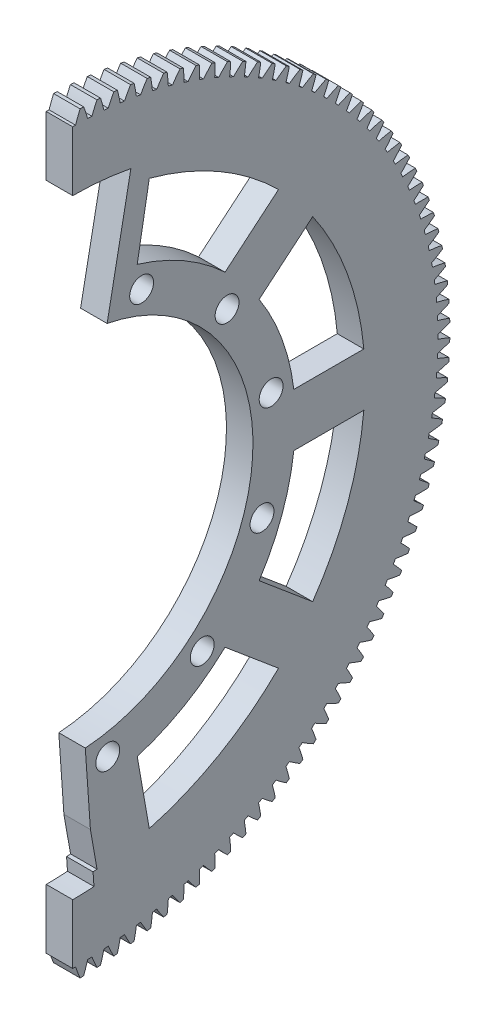
from build123d import *

# Parameters (mm, degrees)
SPUR_START                      = -20.891266915
SPUR_GEAR_AM_OUTLINE_R          = 55
SPUR_GEAR_AM_DEPTH              = 5
SKETCH4_R                       = 60.613652159
SKETCH4_R_2                     = 60
BOSS_EXTRUDE1_DEPTH             = 5
CUT_EXTRUDE1_DEPTH              = 103.636877326
CUT_EXTRUDE1_DEPTH_BACK         = 103.636877326
SKETCH5_R                       = 42
SKETCH5_R_2                     = 34
BOSS_EXTRUDE2_DEPTH             = 5
SKETCH8_W                       = 33.111314858
SKETCH8_H                       = 10
BOSS_EXTRUDE3_DEPTH             = 5
CIRPATTERN4_COUNT               = 3
CIRPATTERN4_ANGLE               = 80
CIRPATTERN4_THE_OTHER_WAY_COUNT = 3
CIRPATTERN4_THE_OTHER_WAY_ANGLE = 80
SKETCH6_R                       = 2.25
CUT_EXTRUDE3_DEPTH              = 101.612541733
CIRPATTERN2_COUNT               = 12
CUT_EXTRUDE4_DEPTH              = 103.636877326
CUT_EXTRUDE4_DEPTH_BACK         = 103.636877326


# Read off the part's stored shape, not the designer's step: spur gear_am
with BuildPart() as part:
    # spur gear_am outline → spur gear_am (new body)
    with BuildSketch(Plane.YZ.offset(SPUR_START)):
        with BuildLine():
            ThreePointArc((1.931612998, 70.839801204), (1.593102565, 70.848206303), (1.254555896, 70.85499688))
            ThreePointArc((1.254555896, 70.85499688), (0.807224415, 69.743494183), (0.407853655, 68.613871815))
            ThreePointArc((0.407853655, 68.613871815), (0, 68.615081622), (-0.407853655, 68.613871815))
            ThreePointArc((-0.407853655, 68.613871815), (-0.807224415, 69.743494183), (-1.254555896, 70.85499688))
            ThreePointArc((-1.254555896, 70.85499688), (-1.593102565, 70.848206303), (-1.931612998, 70.839801204))
            ThreePointArc((-1.931612998, 70.839801204), (-2.328626666, 69.709348265), (-2.67691497, 68.56294565))
            ThreePointArc((-2.67691497, 68.56294565), (-3.084412222, 68.545855954), (-3.491800918, 68.52634908))
            ThreePointArc((-3.491800918, 68.52634908), (-3.941449854, 69.636916292), (-4.438198282, 70.727230329))
            ThreePointArc((-4.438198282, 70.727230329), (-4.776099398, 70.705257751), (-5.11389188, 70.681673901))
            ThreePointArc((-5.11389188, 70.681673901), (-5.459788203, 69.534547303), (-5.756292645, 68.373673143))
            ThreePointArc((-5.756292645, 68.373673143), (-6.162612848, 68.33831836), (-6.568716158, 68.300553704))
            ThreePointArc((-6.568716158, 68.300553704), (-7.067737737, 69.389829225), (-7.612902727, 70.456758854))
            ThreePointArc((-7.612902727, 70.456758854), (-7.949477803, 70.419648525), (-8.285872065, 70.380933421))
            ThreePointArc((-8.285872065, 70.380933421), (-8.579954453, 69.219443322), (-8.824077913, 68.046435464))
            ThreePointArc((-8.824077913, 68.046435464), (-9.228402792, 67.992886794), (-9.632402878, 67.936940408))
            ThreePointArc((-9.632402878, 67.936940408), (-10.179792137, 69.002730583), (-10.772275799, 70.04412715))
            ThreePointArc((-10.772275799, 70.04412715), (-11.106847018, 69.991953805), (-11.441165607, 69.938185412))
            ThreePointArc((-11.441165607, 69.938185412), (-11.682841816, 68.764670901), (-11.874092662, 67.581891626))
            ThreePointArc((-11.874092662, 67.581891626), (-12.27560796, 67.510256909), (-12.67669122, 67.436241462))
            ThreePointArc((-12.67669122, 67.436241462), (-13.27134579, 68.476399931), (-13.909954941, 69.490166202))
            ThreePointArc((-13.909954941, 69.490166202), (-14.241848521, 69.42303491), (-14.573418163, 69.354321513))
            ThreePointArc((-14.573418163, 69.354321513), (-14.762201492, 68.17114589), (-14.900194569, 66.980977158))
            ThreePointArc((-14.900194569, 66.980977158), (-15.298091689, 66.891400657), (-15.695450394, 66.799465206))
            ThreePointArc((-15.695450394, 66.799465206), (-16.33617272, 67.811897228), (-17.019621285, 68.795991613))
            ThreePointArc((-17.019621285, 68.795991613), (-17.348168836, 68.714037569), (-17.676321795, 68.630517545))
            ThreePointArc((-17.676321795, 68.630517545), (-17.811832057, 67.44006357), (-17.896289466, 66.244902223))
            ThreePointArc((-17.896289466, 66.244902223), (-18.289767096, 66.137564332), (-18.682601019, 66.027894023))
            ThreePointArc((-18.682601019, 66.027894023), (-19.368100771, 67.010560696), (-20.095012376, 67.963001359))
            ThreePointArc((-20.095012376, 67.963001359), (-20.419552248, 67.866389607), (-20.743627667, 67.768231156))
            ThreePointArc((-20.743627667, 67.768231156), (-20.825591964, 66.572896243), (-20.856343619, 65.375149177))
            ThreePointArc((-20.856343619, 65.375149177), (-21.244609346, 65.250266061), (-21.632127372, 65.123081755))
            ThreePointArc((-21.632127372, 65.123081755), (-22.361024045, 66.074004118), (-23.129934787, 66.992872971))
            ThreePointArc((-23.129934787, 66.992872971), (-23.449813399, 66.881798074), (-23.769158633, 66.769198873))
            ThreePointArc((-23.769158633, 66.769198873), (-23.7974119, 65.571390269), (-23.774395871, 64.373469587))
            ThreePointArc((-23.774395871, 64.373469587), (-24.156667781, 64.231292744), (-24.538089499, 64.086850574))
            ThreePointArc((-24.538089499, 64.086850574), (-25.308915192, 65.004113595), (-26.118276588, 65.887560158))
            ThreePointArc((-26.118276588, 65.887560158), (-26.432849747, 65.762245807), (-26.746821677, 65.635432616))
            ThreePointArc((-26.746821677, 65.635432616), (-26.721307015, 64.437562548), (-26.644569654, 63.241880702))
            ThreePointArc((-26.644569654, 63.241880702), (-27.020077901, 63.082696457), (-27.39463518, 62.92128731))
            ThreePointArc((-27.39463518, 62.92128731), (-28.205837552, 63.803043745), (-29.054019655, 64.649288874))
            ThreePointArc((-29.054019655, 64.649288874), (-29.362653853, 64.509987435), (-29.670620182, 64.369215639))
            ThreePointArc((-29.670620182, 64.369215639), (-29.591388974, 63.173696457), (-29.461084819, 61.982661392))
            ThreePointArc((-29.461084819, 61.982661392), (-29.829073181, 61.806790322), (-30.196011711, 61.628739254))
            ThreePointArc((-30.196011711, 61.628739254), (-31.04595711, 62.473213362), (-31.931251794, 63.280552833))
            ThreePointArc((-31.931251794, 63.280552833), (-32.233325482, 63.12754484), (-32.534666007, 62.973097934))
            ThreePointArc((-32.534666007, 62.973097934), (-32.401877814, 61.782337255), (-32.21826928, 60.598347557))
            ThreePointArc((-32.21826928, 60.598347557), (-32.577996676, 60.406143842), (-32.936577493, 60.211809425))
            ThreePointArc((-32.936577493, 60.211809425), (-33.823554241, 61.017300547), (-34.744178641, 61.784108485))
            ThreePointArc((-34.744178641, 61.784108485), (-35.039083483, 61.617702076), (-35.333191344, 61.449891097))
            ThreePointArc((-35.333191344, 61.449891097), (-35.147113584, 60.266286955), (-34.910570435, 59.091727021))
            ThreePointArc((-34.910570435, 59.091727021), (-35.261312422, 58.883577734), (-35.610813391, 58.673351331))
            ThreePointArc((-35.610813391, 58.673351331), (-36.533035235, 59.438237316), (-37.487135335, 60.162969472))
            ThreePointArc((-37.487135335, 60.162969472), (-37.774277433, 59.983499768), (-38.060560336, 59.802662664))
            ThreePointArc((-38.060560336, 59.802662664), (-37.821567745, 58.628598679), (-37.532566347, 57.465833917))
            ThreePointArc((-37.532566347, 57.465833917), (-37.873616578, 57.242158242), (-38.213333851, 57.016463222))
            ThreePointArc((-38.213333851, 57.016463222), (-39.168943559, 57.739203691), (-40.154597929, 58.420400551))
            ThreePointArc((-40.154597929, 58.420400551), (-40.433399015, 58.228228979), (-40.711280424, 58.034729932))
            ThreePointArc((-40.711280424, 58.034729932), (-40.419854301, 56.872570514), (-40.078976665, 55.723942578))
            ThreePointArc((-40.078976665, 55.723942578), (-40.40964831, 55.485190969), (-40.738897741, 55.244481851))
            ThreePointArc((-40.738897741, 55.244481851), (-41.725970842, 55.9236213), (-42.741194505, 56.559911024))
            ThreePointArc((-42.741194505, 56.559911024), (-43.011093113, 56.355424593), (-43.280013412, 56.149653285))
            ThreePointArc((-43.280013412, 56.149653285), (-42.936740651, 55.001738867), (-42.544673258, 53.86956094))
            ThreePointArc((-42.544673258, 53.86956094), (-42.864300388, 53.616214211), (-43.182418913, 53.360975751))
            ThreePointArc((-43.182418913, 53.360975751), (-44.198967574, 53.995146485), (-45.241716005, 54.58524767))
            ThreePointArc((-45.241716005, 54.58524767), (-45.502168593, 54.368858188), (-45.761586213, 54.151229014))
            ThreePointArc((-45.761586213, 54.151229014), (-45.367158118, 53.019871344), (-44.924690541, 51.906423482))
            ThreePointArc((-44.924690541, 51.906423482), (-45.23262947, 51.638991839), (-45.538976441, 51.369738053))
            ThreePointArc((-45.538976441, 51.369738053), (-46.582953466, 51.957662937), (-47.651126709, 52.500387198))
            ThreePointArc((-47.651126709, 52.500387198), (-47.901608761, 52.272530444), (-48.151001269, 52.043481681))
            ThreePointArc((-48.151001269, 52.043481681), (-47.706212167, 50.930959162), (-47.214235476, 49.8384837))
            ThreePointArc((-47.214235476, 49.8384837), (-47.509866056, 49.557505715), (-47.80382453, 49.274778846))
            ThreePointArc((-47.80382453, 49.274778846), (-48.87312749, 49.815273876), (-49.964574385, 50.309528238))
            ThreePointArc((-49.964574385, 50.309528238), (-50.204581465, 50.070663086), (-50.443446616, 49.830656007))
            ThreePointArc((-50.443446616, 49.830656007), (-49.949192254, 48.739209112), (-49.408697224, 47.669906152))
            ThreePointArc((-49.408697224, 47.669906152), (-49.691424093, 47.375947678), (-49.972402078, 47.080317098))
            ThreePointArc((-49.972402078, 47.080317098), (-51.064877539, 47.57229379), (-52.177400058, 48.017082891))
            ThreePointArc((-52.177400058, 48.017082891), (-52.406448822, 47.767690384), (-52.634305575, 47.517208331))
            ThreePointArc((-52.634305575, 47.517208331), (-52.091581314, 46.449035089), (-51.503656431, 45.405058063))
            ThreePointArc((-51.503656431, 45.405058063), (-51.772910216, 45.098711092), (-52.040341859, 44.790772163))
            ThreePointArc((-52.040341859, 44.790772163), (-53.153789721, 45.233239741), (-54.285147391, 45.627667835))
            ThreePointArc((-54.285147391, 45.627667835), (-54.502776565, 45.368250215), (-54.719166048, 45.107797627))
            ThreePointArc((-54.719166048, 45.107797627), (-54.129064863, 44.065049196), (-53.494894128, 43.048500536))
            ThreePointArc((-53.494894128, 43.048500536), (-53.750132588, 42.73038201), (-54.003479317, 42.41075488))
            ThreePointArc((-54.003479317, 42.41075488), (-55.135657244, 42.802822273), (-56.283571662, 43.146095034))
            ThreePointArc((-56.283571662, 43.146095034), (-56.489342971, 42.877174735), (-56.693829402, 42.607276128))
            ThreePointArc((-56.693829402, 42.607276128), (-56.057539678, 41.592052465), (-55.378400228, 40.604979364))
            ThreePointArc((-55.378400228, 40.604979364), (-55.619109346, 40.275729932), (-55.857860955, 39.945058287))
            ThreePointArc((-55.857860955, 39.945058287), (-57.006488891, 40.285935924), (-58.16864831, 40.577362047))
            ThreePointArc((-58.16864831, 40.577362047), (-58.362147357, 40.299480637), (-58.554318929, 40.020679551))
            ThreePointArc((-58.554318929, 40.020679551), (-57.873122069, 39.035025181), (-57.1503816, 38.079415473))
            ThreePointArc((-57.1503816, 38.079415473), (-57.37607662, 37.7396982), (-57.599752295, 37.398647969))
            ThreePointArc((-57.599752295, 37.398647969), (-58.762517056, 37.687649367), (-59.936581041, 37.926641958))
            ThreePointArc((-59.936581041, 37.926641958), (-60.117418145, 37.640359055), (-60.29688785, 37.353216958))
            ThreePointArc((-60.29688785, 37.353216958), (-59.572155694, 36.399116858), (-58.807269709, 35.476895014))
            ThreePointArc((-58.807269709, 35.476895014), (-59.017496111, 35.127394045), (-59.225645399, 34.776652057))
            ThreePointArc((-59.225645399, 34.776652057), (-60.400205333, 35.013195206), (-61.583809475, 35.199272966))
            ThreePointArc((-61.583809475, 35.199272966), (-61.751620454, 34.905165105), (-61.918026863, 34.610260263))
            ThreePointArc((-61.918026863, 34.610260263), (-61.151218925, 33.689635863), (-60.345727803, 32.802659115))
            ThreePointArc((-60.345727803, 32.802659115), (-60.54006222, 32.444078299), (-60.732265935, 32.084350903))
            ThreePointArc((-60.732265935, 32.084350903), (-61.916255633, 32.267959436), (-63.107016312, 32.400747629))
            ThreePointArc((-63.107016312, 32.400747629), (-63.261463217, 32.099407104), (-63.41447121, 31.797333416))
            ThreePointArc((-63.41447121, 31.797333416), (-62.607131739, 30.912038732), (-61.762657632, 30.062093333))
            ThreePointArc((-61.762657632, 30.062093333), (-61.940708699, 29.695154802), (-62.11657977, 29.327166441))
            ThreePointArc((-62.11657977, 29.327166441), (-63.307614835, 29.457470596), (-64.503134017, 29.536701805))
            ThreePointArc((-64.503134017, 29.536701805), (-64.643905813, 29.228735475), (-64.783207252, 28.920101278))
            ThreePointArc((-64.783207252, 28.920101278), (-63.936962122, 28.071919175), (-63.055205688, 27.260716802))
            ThreePointArc((-63.055205688, 27.260716802), (-63.216614835, 26.886159523), (-63.37579908, 26.510651276))
            ThreePointArc((-63.37579908, 26.510651276), (-64.571480926, 26.587388637), (-65.769350994, 26.6129033))
            ThreePointArc((-65.769350994, 26.6129033), (-65.896164185, 26.298931369), (-66.021478536, 25.98435821))
            ThreePointArc((-66.021478536, 25.98435821), (-65.138031973, 25.174996814), (-64.220768952, 24.404171121))
            ThreePointArc((-64.220768952, 24.404171121), (-64.365211122, 24.022749403), (-64.507387964, 23.640477493))
            ThreePointArc((-64.507387964, 23.640477493), (-65.705308647, 23.663493522), (-66.903117251, 23.635240255))
            ThreePointArc((-66.903117251, 23.635240255), (-67.015716452, 23.315895021), (-67.126791348, 22.99601641))
            ThreePointArc((-67.126791348, 22.99601641), (-66.207922495, 22.227105667), (-65.257000133, 21.498208994))
            ThreePointArc((-65.257000133, 21.498208994), (-65.384184439, 21.110690969), (-65.509067554, 20.722425241))
            ThreePointArc((-65.509067554, 20.722425241), (-66.70681462, 20.691673586), (-67.902149533, 20.609709289))
            ThreePointArc((-67.902149533, 20.609709289), (-68.000307985, 20.28563387), (-68.096919737, 19.961093999))
            ThreePointArc((-68.096919737, 19.961093999), (-67.144479074, 19.234182393), (-66.161812401, 18.548682641))
            ThreePointArc((-66.161812401, 18.548682641), (-66.27148271, 18.155848718), (-66.378820601, 17.762371089))
            ThreePointArc((-66.378820601, 17.762371089), (-67.573981948, 17.67791368), (-68.764435923, 17.542403417))
            ThreePointArc((-68.764435923, 17.542403417), (-68.847955947, 17.214250458), (-68.929909991, 16.885702907))
            ThreePointArc((-68.929909991, 16.885702907), (-67.945815606, 16.202254342), (-66.933383584, 15.561532016))
            ThreePointArc((-66.933383584, 15.561532016), (-67.025319035, 15.164173311), (-67.114895536, 14.766276191))
            ThreePointArc((-67.114895536, 14.766276191), (-68.305064268, 14.628283114), (-69.48823989, 14.439499785))
            ThreePointArc((-69.48823989, 14.439499785), (-69.556953288, 14.107930143), (-69.62408458, 13.776036563))
            ThreePointArc((-69.62408458, 13.776036563), (-68.610318308, 13.137427413), (-67.570159839, 12.542772842))
            ThreePointArc((-67.570159839, 12.542772842), (-67.644175287, 12.141689583), (-67.715810004, 11.740174284))
            ThreePointArc((-67.715810004, 11.740174284), (-68.898589279, 11.548923439), (-70.07210379, 11.307247229))
            ThreePointArc((-70.07210379, 11.307247229), (-70.125872182, 10.97292864), (-70.178045528, 10.638357421))
            ThreePointArc((-70.178045528, 10.638357421), (-69.136648961, 10.045873759), (-68.070858786, 9.4984845))
            ThreePointArc((-68.070858786, 9.4984845), (-68.126805172, 9.094484414), (-68.180353842, 8.690159535))
            ThreePointArc((-68.180353842, 8.690159535), (-69.3533617, 8.446036075), (-70.514851798, 8.151953688))
            ThreePointArc((-70.514851798, 8.151953688), (-70.553566902, 7.815559426), (-70.590677232, 7.478984349))
            ThreePointArc((-70.590677232, 7.478984349), (-69.523747603, 6.93381936), (-68.434472081, 6.43479778))
            ThreePointArc((-68.434472081, 6.43479778), (-68.472236738, 6.02869447), (-68.507591521, 5.622374268))
            ThreePointArc((-68.507591521, 5.622374268), (-69.66846568, 5.325869825), (-70.815592279, 4.979973503))
            ThreePointArc((-70.815592279, 4.979973503), (-70.839176128, 4.642181021), (-70.861148707, 4.304279904))
            ThreePointArc((-70.861148707, 4.304279904), (-69.77083467, 3.807531476), (-68.660267458, 3.35788254))
            ThreePointArc((-68.660267458, 3.35788254), (-68.679774332, 2.950493844), (-68.696864028, 2.542996593))
            ThreePointArc((-68.696864028, 2.542996593), (-69.843266643, 2.194708288), (-70.973719581, 1.79769462))
            ThreePointArc((-70.973719581, 1.79769462), (-70.982124681, 1.459184187), (-70.988915258, 1.120637519))
            ThreePointArc((-70.988915258, 1.120637519), (-69.877412561, 0.673306038), (-68.747790193, 0.273935277))
            ThreePointArc((-68.747790193, 0.273935277), (-68.749, -0.133918378), (-68.747790193, -0.541772033))
            ThreePointArc((-68.747790193, -0.541772033), (-69.877412561, -0.941142793), (-70.988915258, -1.388474274))
            ThreePointArc((-70.988915258, -1.388474274), (-70.982124681, -1.727020942), (-70.973719581, -2.065531375))
            ThreePointArc((-70.973719581, -2.065531375), (-69.843266643, -2.462545043), (-68.696864028, -2.810833348))
            ThreePointArc((-68.696864028, -2.810833348), (-68.679774332, -3.218330599), (-68.660267458, -3.625719295))
            ThreePointArc((-68.660267458, -3.625719295), (-69.77083467, -4.075368232), (-70.861148707, -4.57211666))
            ThreePointArc((-70.861148707, -4.57211666), (-70.839176128, -4.910017776), (-70.815592279, -5.247810258))
            ThreePointArc((-70.815592279, -5.247810258), (-69.66846568, -5.59370658), (-68.507591521, -5.890211023))
            ThreePointArc((-68.507591521, -5.890211023), (-68.472236738, -6.296531225), (-68.434472081, -6.702634535))
            ThreePointArc((-68.434472081, -6.702634535), (-69.523747603, -7.201656115), (-70.590677232, -7.746821104))
            ThreePointArc((-70.590677232, -7.746821104), (-70.553566902, -8.083396181), (-70.514851798, -8.419790443))
            ThreePointArc((-70.514851798, -8.419790443), (-69.3533617, -8.71387283), (-68.180353842, -8.957996291))
            ThreePointArc((-68.180353842, -8.957996291), (-68.126805172, -9.362321169), (-68.070858786, -9.766321255))
            ThreePointArc((-68.070858786, -9.766321255), (-69.136648961, -10.313710515), (-70.178045528, -10.906194176))
            ThreePointArc((-70.178045528, -10.906194176), (-70.125872182, -11.240765395), (-70.07210379, -11.575083984))
            ThreePointArc((-70.07210379, -11.575083984), (-68.898589279, -11.816760194), (-67.715810004, -12.00801104))
            ThreePointArc((-67.715810004, -12.00801104), (-67.644175287, -12.409526338), (-67.570159839, -12.810609598))
            ThreePointArc((-67.570159839, -12.810609598), (-68.610318309, -13.405264168), (-69.62408458, -14.043873318))
            ThreePointArc((-69.62408458, -14.043873318), (-69.556953288, -14.375766898), (-69.48823989, -14.707336541))
            ThreePointArc((-69.48823989, -14.707336541), (-68.305064267, -14.896119869), (-67.114895536, -15.034112946))
            ThreePointArc((-67.114895536, -15.034112946), (-67.025319035, -15.432010066), (-66.933383584, -15.829368771))
            ThreePointArc((-66.933383584, -15.829368771), (-67.945815606, -16.470091097), (-68.929909991, -17.153539662))
            ThreePointArc((-68.929909991, -17.153539662), (-68.847955947, -17.482087213), (-68.764435923, -17.810240172))
            ThreePointArc((-68.764435923, -17.810240172), (-67.573981948, -17.945750435), (-66.378820601, -18.030207844))
            ThreePointArc((-66.378820601, -18.030207844), (-66.27148271, -18.423685473), (-66.161812401, -18.816519396))
            ThreePointArc((-66.161812401, -18.816519396), (-67.144479073, -19.502019149), (-68.096919737, -20.228930754))
            ThreePointArc((-68.096919737, -20.228930754), (-68.000307985, -20.553470625), (-67.902149533, -20.877546044))
            ThreePointArc((-67.902149533, -20.877546044), (-66.70681462, -20.959510342), (-65.509067554, -20.990261997))
            ThreePointArc((-65.509067554, -20.990261997), (-65.384184439, -21.378527724), (-65.257000133, -21.766045749))
            ThreePointArc((-65.257000133, -21.766045749), (-66.207922495, -22.494942422), (-67.126791348, -23.263853165))
            ThreePointArc((-67.126791348, -23.263853165), (-67.015716452, -23.583731777), (-66.903117251, -23.903077011))
            ThreePointArc((-66.903117251, -23.903077011), (-65.705308647, -23.931330277), (-64.507387964, -23.908314249))
            ThreePointArc((-64.507387964, -23.908314249), (-64.365211122, -24.290586159), (-64.220768952, -24.672007877))
            ThreePointArc((-64.220768952, -24.672007877), (-65.138031973, -25.44283357), (-66.021478536, -26.252194966))
            ThreePointArc((-66.021478536, -26.252194966), (-65.896164185, -26.566768124), (-65.769350994, -26.880740055))
            ThreePointArc((-65.769350994, -26.880740055), (-64.571480926, -26.855225393), (-63.37579908, -26.778488031))
            ThreePointArc((-63.37579908, -26.778488031), (-63.216614835, -27.153996278), (-63.055205688, -27.528553557))
            ThreePointArc((-63.055205688, -27.528553557), (-63.936962122, -28.33975593), (-64.783207252, -29.187938033))
            ThreePointArc((-64.783207252, -29.187938033), (-64.643905813, -29.49657223), (-64.503134017, -29.80453856))
            ThreePointArc((-64.503134017, -29.80453856), (-63.307614835, -29.725307352), (-62.11657977, -29.595003197))
            ThreePointArc((-62.11657977, -29.595003197), (-61.940708699, -29.962991558), (-61.762657632, -30.329930088))
            ThreePointArc((-61.762657632, -30.329930088), (-62.607131739, -31.179875487), (-63.41447121, -32.065170171))
            ThreePointArc((-63.41447121, -32.065170171), (-63.261463217, -32.367243859), (-63.107016312, -32.668584385))
            ThreePointArc((-63.107016312, -32.668584385), (-61.916255633, -32.535796192), (-60.732265935, -32.352187658))
            ThreePointArc((-60.732265935, -32.352187658), (-60.54006222, -32.711915054), (-60.345727803, -33.070495871))
            ThreePointArc((-60.345727803, -33.070495871), (-61.151218925, -33.957472618), (-61.918026863, -34.878097018))
            ThreePointArc((-61.918026863, -34.878097018), (-61.751620454, -35.17300186), (-61.583809475, -35.467109722))
            ThreePointArc((-61.583809475, -35.467109722), (-60.400205333, -35.281031962), (-59.225645399, -35.044488813))
            ThreePointArc((-59.225645399, -35.044488813), (-59.017496111, -35.3952308), (-58.807269709, -35.744731769))
            ThreePointArc((-58.807269709, -35.744731769), (-59.572155694, -36.666953613), (-60.29688785, -37.621053713))
            ThreePointArc((-60.29688785, -37.621053713), (-60.117418145, -37.90819581), (-59.936581041, -38.194478713))
            ThreePointArc((-59.936581041, -38.194478713), (-58.762517056, -37.955486122), (-57.599752295, -37.666484724))
            ThreePointArc((-57.599752295, -37.666484724), (-57.37607662, -38.007534955), (-57.1503816, -38.347252228))
            ThreePointArc((-57.1503816, -38.347252228), (-57.873122069, -39.302861936), (-58.554318929, -40.288516306))
            ThreePointArc((-58.554318929, -40.288516306), (-58.362147357, -40.567317393), (-58.16864831, -40.845198802))
            ThreePointArc((-58.16864831, -40.845198802), (-57.006488892, -40.553772679), (-55.857860955, -40.212895043))
            ThreePointArc((-55.857860955, -40.212895043), (-55.619109346, -40.543566688), (-55.378400228, -40.872816119))
            ThreePointArc((-55.378400228, -40.872816119), (-56.057539678, -41.85988922), (-56.693829402, -42.875112883))
            ThreePointArc((-56.693829402, -42.875112883), (-56.489342971, -43.14501149), (-56.283571662, -43.41393179))
            ThreePointArc((-56.283571662, -43.41393179), (-55.135657244, -43.070659028), (-54.003479317, -42.678591635))
            ThreePointArc((-54.003479317, -42.678591635), (-53.750132588, -42.998218766), (-53.494894128, -43.316337291))
            ThreePointArc((-53.494894128, -43.316337291), (-54.129064863, -44.332885951), (-54.719166048, -45.375634382))
            ThreePointArc((-54.719166048, -45.375634382), (-54.502776565, -45.63608697), (-54.285147391, -45.89550459))
            ThreePointArc((-54.285147391, -45.89550459), (-53.153789721, -45.501076496), (-52.040341859, -45.058608918))
            ThreePointArc((-52.040341859, -45.058608918), (-51.772910216, -45.366547847), (-51.503656431, -45.672894818))
            ThreePointArc((-51.503656431, -45.672894818), (-52.091581314, -46.716871844), (-52.634305575, -47.785045086))
            ThreePointArc((-52.634305575, -47.785045086), (-52.406448822, -48.035527139), (-52.177400058, -48.284919646))
            ThreePointArc((-52.177400058, -48.284919646), (-51.064877539, -47.840130545), (-49.972402078, -47.348153853))
            ThreePointArc((-49.972402078, -47.348153853), (-49.691424093, -47.643784433), (-49.408697224, -47.937742907))
            ThreePointArc((-49.408697224, -47.937742907), (-49.949192254, -49.007045868), (-50.443446616, -50.098492763))
            ThreePointArc((-50.443446616, -50.098492763), (-50.204581464, -50.338499842), (-49.964574385, -50.577364994))
            ThreePointArc((-49.964574385, -50.577364994), (-48.87312749, -50.083110631), (-47.80382453, -49.542615601))
            ThreePointArc((-47.80382453, -49.542615601), (-47.509866055, -49.825342471), (-47.214235476, -50.106320456))
            ThreePointArc((-47.214235476, -50.106320456), (-47.706212167, -51.198795918), (-48.151001269, -52.311318436))
            ThreePointArc((-48.151001269, -52.311318436), (-47.901608761, -52.540367199), (-47.651126709, -52.768223953))
            ThreePointArc((-47.651126709, -52.768223953), (-46.582953466, -52.225499692), (-45.538976441, -51.637574808))
            ThreePointArc((-45.538976441, -51.637574808), (-45.23262947, -51.906828594), (-44.924690541, -52.174260237))
            ThreePointArc((-44.924690541, -52.174260237), (-45.367158118, -53.287708099), (-45.761586213, -54.419065769))
            ThreePointArc((-45.761586213, -54.419065769), (-45.502168593, -54.636694943), (-45.241716005, -54.853084425))
            ThreePointArc((-45.241716005, -54.853084425), (-44.198967574, -54.26298324), (-43.182418913, -53.628812506))
            ThreePointArc((-43.182418913, -53.628812506), (-42.864300388, -53.884050966), (-42.544673258, -54.137397695))
            ThreePointArc((-42.544673258, -54.137397695), (-42.936740651, -55.269575622), (-43.280013412, -56.41749004))
            ThreePointArc((-43.280013412, -56.41749004), (-43.011093112, -56.623261348), (-42.741194505, -56.82774778))
            ThreePointArc((-42.741194505, -56.82774778), (-41.725970842, -56.191458056), (-40.738897741, -55.512318606))
            ThreePointArc((-40.738897741, -55.512318606), (-40.40964831, -55.753027724), (-40.078976665, -55.991779333))
            ThreePointArc((-40.078976665, -55.991779333), (-40.419854301, -57.140407269), (-40.711280424, -58.302566688))
            ThreePointArc((-40.711280424, -58.302566688), (-40.433399015, -58.496065734), (-40.154597929, -58.688237306))
            ThreePointArc((-40.154597929, -58.688237306), (-39.168943558, -58.007040447), (-38.213333851, -57.284299978))
            ThreePointArc((-38.213333851, -57.284299978), (-37.873616578, -57.509994998), (-37.532566347, -57.733670672))
            ThreePointArc((-37.532566347, -57.733670672), (-37.821567745, -58.896435434), (-38.060560336, -60.070499419))
            ThreePointArc((-38.060560336, -60.070499419), (-37.774277433, -60.251336523), (-37.487135335, -60.430806227))
            ThreePointArc((-37.487135335, -60.430806227), (-36.533035235, -59.706074071), (-35.610813391, -58.941188087))
            ThreePointArc((-35.610813391, -58.941188087), (-35.261312422, -59.151414489), (-34.910570435, -59.359563776))
            ThreePointArc((-34.910570435, -59.359563776), (-35.147113584, -60.53412371), (-35.333191344, -61.717727853))
            ThreePointArc((-35.333191344, -61.717727853), (-35.039083483, -61.885538832), (-34.744178641, -62.051945241))
            ThreePointArc((-34.744178641, -62.051945241), (-33.823554241, -61.285137303), (-32.936577493, -60.47964618))
            ThreePointArc((-32.936577493, -60.47964618), (-32.577996676, -60.673980597), (-32.21826928, -60.866184312))
            ThreePointArc((-32.21826928, -60.866184312), (-32.401877814, -62.050174011), (-32.534666007, -63.24093469))
            ThreePointArc((-32.534666007, -63.24093469), (-32.233325482, -63.395381595), (-31.931251794, -63.548389588))
            ThreePointArc((-31.931251794, -63.548389588), (-31.04595711, -62.741050117), (-30.196011711, -61.89657601))
            ThreePointArc((-30.196011711, -61.89657601), (-29.829073181, -62.074627077), (-29.461084819, -62.250498147))
            ThreePointArc((-29.461084819, -62.250498147), (-29.591388974, -63.441533212), (-29.670620182, -64.637052395))
            ThreePointArc((-29.670620182, -64.637052395), (-29.362653852, -64.77782419), (-29.054019655, -64.91712563))
            ThreePointArc((-29.054019655, -64.91712563), (-28.205837552, -64.0708805), (-27.39463518, -63.189124066))
            ThreePointArc((-27.39463518, -63.189124066), (-27.020077901, -63.350533213), (-26.644569654, -63.509717457))
            ThreePointArc((-26.644569654, -63.509717457), (-26.721307015, -64.705399303), (-26.746821677, -65.903269372))
            ThreePointArc((-26.746821677, -65.903269372), (-26.432849747, -66.030082563), (-26.118276588, -66.155396914))
            ThreePointArc((-26.118276588, -66.155396914), (-25.308915192, -65.27195035), (-24.538089499, -64.354687329))
            ThreePointArc((-24.538089499, -64.354687329), (-24.156667781, -64.499129499), (-23.774395871, -64.641306342))
            ThreePointArc((-23.774395871, -64.641306342), (-23.7974119, -65.839227024), (-23.769158633, -67.037035628))
            ThreePointArc((-23.769158633, -67.037035628), (-23.449813399, -67.14963483), (-23.129934787, -67.260709726))
            ThreePointArc((-23.129934787, -67.260709726), (-22.361024045, -66.341840873), (-21.632127372, -65.390918511))
            ThreePointArc((-21.632127372, -65.390918511), (-21.244609346, -65.518102816), (-20.856343619, -65.642985932))
            ThreePointArc((-20.856343619, -65.642985932), (-20.825591964, -66.840732998), (-20.743627667, -68.036067911))
            ThreePointArc((-20.743627667, -68.036067911), (-20.419552248, -68.134226362), (-20.095012376, -68.230838114))
            ThreePointArc((-20.095012376, -68.230838114), (-19.368100771, -67.278397451), (-18.682601019, -66.295730779))
            ThreePointArc((-18.682601019, -66.295730779), (-18.289767096, -66.405401088), (-17.896289466, -66.512738978))
            ThreePointArc((-17.896289466, -66.512738978), (-17.811832057, -67.707900325), (-17.676321795, -68.898354301))
            ThreePointArc((-17.676321795, -68.898354301), (-17.348168836, -68.981874324), (-17.019621285, -69.063828368))
            ThreePointArc((-17.019621285, -69.063828368), (-16.33617272, -68.079733984), (-15.695450394, -67.067301961))
            ThreePointArc((-15.695450394, -67.067301961), (-15.298091689, -67.159237412), (-14.900194569, -67.248813914))
            ThreePointArc((-14.900194569, -67.248813914), (-14.762201492, -68.438982646), (-14.573418163, -69.622158268))
            ThreePointArc((-14.573418163, -69.622158268), (-14.241848521, -69.690871666), (-13.909954941, -69.758002957))
            ThreePointArc((-13.909954941, -69.758002957), (-13.27134579, -68.744236686), (-12.67669122, -67.704078217))
            ThreePointArc((-12.67669122, -67.704078217), (-12.27560796, -67.778093664), (-11.874092662, -67.849728381))
            ThreePointArc((-11.874092662, -67.849728381), (-11.682841816, -69.032507656), (-11.441165607, -70.206022168))
            ThreePointArc((-11.441165607, -70.206022168), (-11.106847018, -70.25979056), (-10.772275799, -70.311963906))
            ThreePointArc((-10.772275799, -70.311963906), (-10.179792137, -69.270567339), (-9.632402878, -68.204777163))
            ThreePointArc((-9.632402878, -68.204777163), (-9.228402792, -68.260723549), (-8.824077913, -68.314272219))
            ThreePointArc((-8.824077913, -68.314272219), (-8.579954453, -69.487280078), (-8.285872065, -70.648770176))
            ThreePointArc((-8.285872065, -70.648770176), (-7.949477803, -70.68748528), (-7.612902727, -70.72459561))
            ThreePointArc((-7.612902727, -70.72459561), (-7.067737737, -69.657665981), (-6.568716158, -68.568390459))
            ThreePointArc((-6.568716158, -68.568390459), (-6.162612848, -68.606155116), (-5.756292645, -68.641509898))
            ThreePointArc((-5.756292645, -68.641509898), (-5.459788203, -69.802384058), (-5.11389188, -70.949510657))
            ThreePointArc((-5.11389188, -70.949510657), (-4.776099398, -70.973094506), (-4.438198282, -70.995067084))
            ThreePointArc((-4.438198282, -70.995067084), (-3.941449854, -69.904753048), (-3.491800918, -68.794185835))
            ThreePointArc((-3.491800918, -68.794185835), (-3.084412222, -68.813692709), (-2.67691497, -68.830782405))
            ThreePointArc((-2.67691497, -68.830782405), (-2.328626666, -69.97718502), (-1.931612998, -71.107637959))
            ThreePointArc((-1.931612998, -71.107637959), (-1.593102565, -71.116043059), (-1.254555896, -71.122833636))
            ThreePointArc((-1.254555896, -71.122833636), (-0.807224415, -70.011330939), (-0.407853655, -68.88170857))
            ThreePointArc((-0.407853655, -68.88170857), (0, -68.882918378), (0.407853655, -68.88170857))
            ThreePointArc((0.407853655, -68.88170857), (0.807224415, -70.011330939), (1.254555896, -71.122833636))
            ThreePointArc((1.254555896, -71.122833636), (1.593102565, -71.116043059), (1.931612998, -71.107637959))
            ThreePointArc((1.931612998, -71.107637959), (2.328626666, -69.97718502), (2.67691497, -68.830782405))
            ThreePointArc((2.67691497, -68.830782405), (3.084412222, -68.813692709), (3.491800918, -68.794185835))
            ThreePointArc((3.491800918, -68.794185835), (3.941449854, -69.904753048), (4.438198282, -70.995067084))
            ThreePointArc((4.438198282, -70.995067084), (4.776099398, -70.973094506), (5.11389188, -70.949510657))
            ThreePointArc((5.11389188, -70.949510657), (5.459788203, -69.802384058), (5.756292645, -68.641509898))
            ThreePointArc((5.756292645, -68.641509898), (6.162612848, -68.606155116), (6.568716158, -68.568390459))
            ThreePointArc((6.568716158, -68.568390459), (7.067737737, -69.657665981), (7.612902727, -70.72459561))
            ThreePointArc((7.612902727, -70.72459561), (7.949477803, -70.68748528), (8.285872065, -70.648770176))
            ThreePointArc((8.285872065, -70.648770176), (8.579954453, -69.487280078), (8.824077913, -68.314272219))
            ThreePointArc((8.824077913, -68.314272219), (9.228402792, -68.260723549), (9.632402878, -68.204777163))
            ThreePointArc((9.632402878, -68.204777163), (10.179792137, -69.270567339), (10.772275799, -70.311963906))
            ThreePointArc((10.772275799, -70.311963906), (11.106847018, -70.25979056), (11.441165607, -70.206022168))
            ThreePointArc((11.441165607, -70.206022168), (11.682841816, -69.032507656), (11.874092662, -67.849728381))
            ThreePointArc((11.874092662, -67.849728381), (12.27560796, -67.778093664), (12.67669122, -67.704078217))
            ThreePointArc((12.67669122, -67.704078217), (13.27134579, -68.744236686), (13.909954941, -69.758002957))
            ThreePointArc((13.909954941, -69.758002957), (14.241848521, -69.690871666), (14.573418163, -69.622158268))
            ThreePointArc((14.573418163, -69.622158268), (14.762201492, -68.438982646), (14.900194569, -67.248813914))
            ThreePointArc((14.900194569, -67.248813914), (15.298091689, -67.159237412), (15.695450394, -67.067301961))
            ThreePointArc((15.695450394, -67.067301961), (16.33617272, -68.079733984), (17.019621285, -69.063828368))
            ThreePointArc((17.019621285, -69.063828368), (17.348168836, -68.981874324), (17.676321795, -68.898354301))
            ThreePointArc((17.676321795, -68.898354301), (17.811832057, -67.707900325), (17.896289466, -66.512738978))
            ThreePointArc((17.896289466, -66.512738978), (18.289767096, -66.405401088), (18.682601019, -66.295730779))
            ThreePointArc((18.682601019, -66.295730779), (19.368100771, -67.278397451), (20.095012376, -68.230838114))
            ThreePointArc((20.095012376, -68.230838114), (20.419552248, -68.134226362), (20.743627667, -68.036067911))
            ThreePointArc((20.743627667, -68.036067911), (20.825591964, -66.840732998), (20.856343619, -65.642985932))
            ThreePointArc((20.856343619, -65.642985932), (21.244609346, -65.518102816), (21.632127372, -65.390918511))
            ThreePointArc((21.632127372, -65.390918511), (22.361024045, -66.341840873), (23.129934787, -67.260709726))
            ThreePointArc((23.129934787, -67.260709726), (23.449813399, -67.14963483), (23.769158633, -67.037035628))
            ThreePointArc((23.769158633, -67.037035628), (23.7974119, -65.839227024), (23.774395871, -64.641306342))
            ThreePointArc((23.774395871, -64.641306342), (24.156667781, -64.499129499), (24.538089499, -64.354687329))
            ThreePointArc((24.538089499, -64.354687329), (25.308915192, -65.27195035), (26.118276588, -66.155396914))
            ThreePointArc((26.118276588, -66.155396914), (26.432849747, -66.030082563), (26.746821677, -65.903269372))
            ThreePointArc((26.746821677, -65.903269372), (26.721307015, -64.705399303), (26.644569654, -63.509717457))
            ThreePointArc((26.644569654, -63.509717457), (27.020077901, -63.350533213), (27.39463518, -63.189124066))
            ThreePointArc((27.39463518, -63.189124066), (28.205837552, -64.0708805), (29.054019655, -64.91712563))
            ThreePointArc((29.054019655, -64.91712563), (29.362653852, -64.77782419), (29.670620182, -64.637052395))
            ThreePointArc((29.670620182, -64.637052395), (29.591388974, -63.441533212), (29.461084819, -62.250498147))
            ThreePointArc((29.461084819, -62.250498147), (29.829073181, -62.074627077), (30.196011711, -61.89657601))
            ThreePointArc((30.196011711, -61.89657601), (31.04595711, -62.741050117), (31.931251794, -63.548389588))
            ThreePointArc((31.931251794, -63.548389588), (32.233325482, -63.395381595), (32.534666007, -63.24093469))
            ThreePointArc((32.534666007, -63.24093469), (32.401877814, -62.050174011), (32.21826928, -60.866184312))
            ThreePointArc((32.21826928, -60.866184312), (32.577996676, -60.673980597), (32.936577493, -60.47964618))
            ThreePointArc((32.936577493, -60.47964618), (33.823554241, -61.285137303), (34.744178641, -62.051945241))
            ThreePointArc((34.744178641, -62.051945241), (35.039083483, -61.885538832), (35.333191344, -61.717727853))
            ThreePointArc((35.333191344, -61.717727853), (35.147113584, -60.53412371), (34.910570435, -59.359563776))
            ThreePointArc((34.910570435, -59.359563776), (35.261312422, -59.151414489), (35.610813391, -58.941188087))
            ThreePointArc((35.610813391, -58.941188087), (36.533035235, -59.706074071), (37.487135335, -60.430806227))
            ThreePointArc((37.487135335, -60.430806227), (37.774277433, -60.251336523), (38.060560336, -60.070499419))
            ThreePointArc((38.060560336, -60.070499419), (37.821567745, -58.896435434), (37.532566347, -57.733670672))
            ThreePointArc((37.532566347, -57.733670672), (37.873616578, -57.509994998), (38.213333851, -57.284299978))
            ThreePointArc((38.213333851, -57.284299978), (39.168943558, -58.007040447), (40.154597929, -58.688237306))
            ThreePointArc((40.154597929, -58.688237306), (40.433399015, -58.496065734), (40.711280424, -58.302566688))
            ThreePointArc((40.711280424, -58.302566688), (40.419854301, -57.140407269), (40.078976665, -55.991779333))
            ThreePointArc((40.078976665, -55.991779333), (40.40964831, -55.753027724), (40.738897741, -55.512318606))
            ThreePointArc((40.738897741, -55.512318606), (41.725970842, -56.191458056), (42.741194505, -56.82774778))
            ThreePointArc((42.741194505, -56.82774778), (43.011093112, -56.623261348), (43.280013412, -56.41749004))
            ThreePointArc((43.280013412, -56.41749004), (42.936740651, -55.269575622), (42.544673258, -54.137397695))
            ThreePointArc((42.544673258, -54.137397695), (42.864300388, -53.884050966), (43.182418913, -53.628812506))
            ThreePointArc((43.182418913, -53.628812506), (44.198967574, -54.26298324), (45.241716005, -54.853084425))
            ThreePointArc((45.241716005, -54.853084425), (45.502168593, -54.636694943), (45.761586213, -54.419065769))
            ThreePointArc((45.761586213, -54.419065769), (45.367158118, -53.287708099), (44.924690541, -52.174260237))
            ThreePointArc((44.924690541, -52.174260237), (45.23262947, -51.906828594), (45.538976441, -51.637574808))
            ThreePointArc((45.538976441, -51.637574808), (46.582953466, -52.225499692), (47.651126709, -52.768223953))
            ThreePointArc((47.651126709, -52.768223953), (47.901608761, -52.540367199), (48.151001269, -52.311318436))
            ThreePointArc((48.151001269, -52.311318436), (47.706212167, -51.198795918), (47.214235476, -50.106320456))
            ThreePointArc((47.214235476, -50.106320456), (47.509866055, -49.825342471), (47.80382453, -49.542615601))
            ThreePointArc((47.80382453, -49.542615601), (48.87312749, -50.083110631), (49.964574385, -50.577364994))
            ThreePointArc((49.964574385, -50.577364994), (50.204581464, -50.338499842), (50.443446616, -50.098492763))
            ThreePointArc((50.443446616, -50.098492763), (49.949192254, -49.007045868), (49.408697224, -47.937742907))
            ThreePointArc((49.408697224, -47.937742907), (49.691424093, -47.643784433), (49.972402078, -47.348153853))
            ThreePointArc((49.972402078, -47.348153853), (51.064877539, -47.840130545), (52.177400058, -48.284919646))
            ThreePointArc((52.177400058, -48.284919646), (52.406448822, -48.035527139), (52.634305575, -47.785045086))
            ThreePointArc((52.634305575, -47.785045086), (52.091581314, -46.716871844), (51.503656431, -45.672894818))
            ThreePointArc((51.503656431, -45.672894818), (51.772910216, -45.366547847), (52.040341859, -45.058608918))
            ThreePointArc((52.040341859, -45.058608918), (53.153789721, -45.501076496), (54.285147391, -45.89550459))
            ThreePointArc((54.285147391, -45.89550459), (54.502776565, -45.63608697), (54.719166048, -45.375634382))
            ThreePointArc((54.719166048, -45.375634382), (54.129064863, -44.332885951), (53.494894128, -43.316337291))
            ThreePointArc((53.494894128, -43.316337291), (53.750132588, -42.998218766), (54.003479317, -42.678591635))
            ThreePointArc((54.003479317, -42.678591635), (55.135657244, -43.070659028), (56.283571662, -43.41393179))
            ThreePointArc((56.283571662, -43.41393179), (56.489342971, -43.14501149), (56.693829402, -42.875112883))
            ThreePointArc((56.693829402, -42.875112883), (56.057539678, -41.85988922), (55.378400228, -40.872816119))
            ThreePointArc((55.378400228, -40.872816119), (55.619109346, -40.543566688), (55.857860955, -40.212895043))
            ThreePointArc((55.857860955, -40.212895043), (57.006488892, -40.553772679), (58.16864831, -40.845198802))
            ThreePointArc((58.16864831, -40.845198802), (58.362147357, -40.567317393), (58.554318929, -40.288516306))
            ThreePointArc((58.554318929, -40.288516306), (57.873122069, -39.302861936), (57.1503816, -38.347252228))
            ThreePointArc((57.1503816, -38.347252228), (57.37607662, -38.007534955), (57.599752295, -37.666484724))
            ThreePointArc((57.599752295, -37.666484724), (58.762517056, -37.955486122), (59.936581041, -38.194478713))
            ThreePointArc((59.936581041, -38.194478713), (60.117418145, -37.90819581), (60.29688785, -37.621053713))
            ThreePointArc((60.29688785, -37.621053713), (59.572155694, -36.666953613), (58.807269709, -35.744731769))
            ThreePointArc((58.807269709, -35.744731769), (59.017496111, -35.3952308), (59.225645399, -35.044488813))
            ThreePointArc((59.225645399, -35.044488813), (60.400205333, -35.281031962), (61.583809475, -35.467109722))
            ThreePointArc((61.583809475, -35.467109722), (61.751620454, -35.17300186), (61.918026863, -34.878097018))
            ThreePointArc((61.918026863, -34.878097018), (61.151218925, -33.957472618), (60.345727803, -33.070495871))
            ThreePointArc((60.345727803, -33.070495871), (60.54006222, -32.711915054), (60.732265935, -32.352187658))
            ThreePointArc((60.732265935, -32.352187658), (61.916255633, -32.535796192), (63.107016312, -32.668584385))
            ThreePointArc((63.107016312, -32.668584385), (63.261463217, -32.367243859), (63.41447121, -32.065170171))
            ThreePointArc((63.41447121, -32.065170171), (62.607131739, -31.179875487), (61.762657632, -30.329930088))
            ThreePointArc((61.762657632, -30.329930088), (61.940708699, -29.962991558), (62.11657977, -29.595003197))
            ThreePointArc((62.11657977, -29.595003197), (63.307614835, -29.725307352), (64.503134017, -29.80453856))
            ThreePointArc((64.503134017, -29.80453856), (64.643905813, -29.49657223), (64.783207252, -29.187938033))
            ThreePointArc((64.783207252, -29.187938033), (63.936962122, -28.33975593), (63.055205688, -27.528553557))
            ThreePointArc((63.055205688, -27.528553557), (63.216614835, -27.153996278), (63.37579908, -26.778488031))
            ThreePointArc((63.37579908, -26.778488031), (64.571480926, -26.855225393), (65.769350994, -26.880740055))
            ThreePointArc((65.769350994, -26.880740055), (65.896164185, -26.566768124), (66.021478536, -26.252194966))
            ThreePointArc((66.021478536, -26.252194966), (65.138031973, -25.44283357), (64.220768952, -24.672007877))
            ThreePointArc((64.220768952, -24.672007877), (64.365211122, -24.290586159), (64.507387964, -23.908314249))
            ThreePointArc((64.507387964, -23.908314249), (65.705308647, -23.931330277), (66.903117251, -23.903077011))
            ThreePointArc((66.903117251, -23.903077011), (67.015716452, -23.583731777), (67.126791348, -23.263853165))
            ThreePointArc((67.126791348, -23.263853165), (66.207922495, -22.494942422), (65.257000133, -21.766045749))
            ThreePointArc((65.257000133, -21.766045749), (65.384184439, -21.378527724), (65.509067554, -20.990261997))
            ThreePointArc((65.509067554, -20.990261997), (66.70681462, -20.959510342), (67.902149533, -20.877546044))
            ThreePointArc((67.902149533, -20.877546044), (68.000307985, -20.553470625), (68.096919737, -20.228930754))
            ThreePointArc((68.096919737, -20.228930754), (67.144479073, -19.502019149), (66.161812401, -18.816519396))
            ThreePointArc((66.161812401, -18.816519396), (66.27148271, -18.423685473), (66.378820601, -18.030207844))
            ThreePointArc((66.378820601, -18.030207844), (67.573981948, -17.945750435), (68.764435923, -17.810240172))
            ThreePointArc((68.764435923, -17.810240172), (68.847955947, -17.482087213), (68.929909991, -17.153539662))
            ThreePointArc((68.929909991, -17.153539662), (67.945815606, -16.470091097), (66.933383584, -15.829368771))
            ThreePointArc((66.933383584, -15.829368771), (67.025319035, -15.432010066), (67.114895536, -15.034112946))
            ThreePointArc((67.114895536, -15.034112946), (68.305064267, -14.896119869), (69.48823989, -14.707336541))
            ThreePointArc((69.48823989, -14.707336541), (69.556953288, -14.375766898), (69.62408458, -14.043873318))
            ThreePointArc((69.62408458, -14.043873318), (68.610318309, -13.405264168), (67.570159839, -12.810609598))
            ThreePointArc((67.570159839, -12.810609598), (67.644175287, -12.409526338), (67.715810004, -12.00801104))
            ThreePointArc((67.715810004, -12.00801104), (68.898589279, -11.816760194), (70.07210379, -11.575083984))
            ThreePointArc((70.07210379, -11.575083984), (70.125872182, -11.240765395), (70.178045528, -10.906194176))
            ThreePointArc((70.178045528, -10.906194176), (69.136648961, -10.313710515), (68.070858786, -9.766321255))
            ThreePointArc((68.070858786, -9.766321255), (68.126805172, -9.362321169), (68.180353842, -8.957996291))
            ThreePointArc((68.180353842, -8.957996291), (69.3533617, -8.71387283), (70.514851798, -8.419790443))
            ThreePointArc((70.514851798, -8.419790443), (70.553566902, -8.083396181), (70.590677232, -7.746821104))
            ThreePointArc((70.590677232, -7.746821104), (69.523747603, -7.201656115), (68.434472081, -6.702634535))
            ThreePointArc((68.434472081, -6.702634535), (68.472236738, -6.296531225), (68.507591521, -5.890211023))
            ThreePointArc((68.507591521, -5.890211023), (69.66846568, -5.59370658), (70.815592279, -5.247810258))
            ThreePointArc((70.815592279, -5.247810258), (70.839176128, -4.910017776), (70.861148707, -4.57211666))
            ThreePointArc((70.861148707, -4.57211666), (69.77083467, -4.075368232), (68.660267458, -3.625719295))
            ThreePointArc((68.660267458, -3.625719295), (68.679774332, -3.218330599), (68.696864028, -2.810833348))
            ThreePointArc((68.696864028, -2.810833348), (69.843266643, -2.462545043), (70.973719581, -2.065531375))
            ThreePointArc((70.973719581, -2.065531375), (70.982124681, -1.727020942), (70.988915258, -1.388474274))
            ThreePointArc((70.988915258, -1.388474274), (69.877412561, -0.941142793), (68.747790193, -0.541772033))
            ThreePointArc((68.747790193, -0.541772033), (68.749, -0.133918378), (68.747790193, 0.273935277))
            ThreePointArc((68.747790193, 0.273935277), (69.877412561, 0.673306038), (70.988915258, 1.120637519))
            ThreePointArc((70.988915258, 1.120637519), (70.982124681, 1.459184187), (70.973719581, 1.79769462))
            ThreePointArc((70.973719581, 1.79769462), (69.843266643, 2.194708288), (68.696864028, 2.542996593))
            ThreePointArc((68.696864028, 2.542996593), (68.679774332, 2.950493844), (68.660267458, 3.35788254))
            ThreePointArc((68.660267458, 3.35788254), (69.77083467, 3.807531476), (70.861148707, 4.304279904))
            ThreePointArc((70.861148707, 4.304279904), (70.839176128, 4.642181021), (70.815592279, 4.979973503))
            ThreePointArc((70.815592279, 4.979973503), (69.66846568, 5.325869825), (68.507591521, 5.622374268))
            ThreePointArc((68.507591521, 5.622374268), (68.472236738, 6.02869447), (68.434472081, 6.43479778))
            ThreePointArc((68.434472081, 6.43479778), (69.523747603, 6.93381936), (70.590677232, 7.478984349))
            ThreePointArc((70.590677232, 7.478984349), (70.553566902, 7.815559426), (70.514851798, 8.151953688))
            ThreePointArc((70.514851798, 8.151953688), (69.3533617, 8.446036075), (68.180353842, 8.690159535))
            ThreePointArc((68.180353842, 8.690159535), (68.126805172, 9.094484414), (68.070858786, 9.4984845))
            ThreePointArc((68.070858786, 9.4984845), (69.136648961, 10.045873759), (70.178045528, 10.638357421))
            ThreePointArc((70.178045528, 10.638357421), (70.125872182, 10.97292864), (70.07210379, 11.307247229))
            ThreePointArc((70.07210379, 11.307247229), (68.898589279, 11.548923439), (67.715810004, 11.740174284))
            ThreePointArc((67.715810004, 11.740174284), (67.644175287, 12.141689583), (67.570159839, 12.542772842))
            ThreePointArc((67.570159839, 12.542772842), (68.610318308, 13.137427413), (69.62408458, 13.776036563))
            ThreePointArc((69.62408458, 13.776036563), (69.556953288, 14.107930143), (69.48823989, 14.439499785))
            ThreePointArc((69.48823989, 14.439499785), (68.305064268, 14.628283114), (67.114895536, 14.766276191))
            ThreePointArc((67.114895536, 14.766276191), (67.025319035, 15.164173311), (66.933383584, 15.561532016))
            ThreePointArc((66.933383584, 15.561532016), (67.945815606, 16.202254342), (68.929909991, 16.885702907))
            ThreePointArc((68.929909991, 16.885702907), (68.847955947, 17.214250458), (68.764435923, 17.542403417))
            ThreePointArc((68.764435923, 17.542403417), (67.573981948, 17.67791368), (66.378820601, 17.762371089))
            ThreePointArc((66.378820601, 17.762371089), (66.27148271, 18.155848718), (66.161812401, 18.548682641))
            ThreePointArc((66.161812401, 18.548682641), (67.144479074, 19.234182393), (68.096919737, 19.961093999))
            ThreePointArc((68.096919737, 19.961093999), (68.000307985, 20.28563387), (67.902149533, 20.609709289))
            ThreePointArc((67.902149533, 20.609709289), (66.70681462, 20.691673586), (65.509067554, 20.722425241))
            ThreePointArc((65.509067554, 20.722425241), (65.384184439, 21.110690969), (65.257000133, 21.498208994))
            ThreePointArc((65.257000133, 21.498208994), (66.207922495, 22.227105667), (67.126791348, 22.99601641))
            ThreePointArc((67.126791348, 22.99601641), (67.015716452, 23.315895021), (66.903117251, 23.635240255))
            ThreePointArc((66.903117251, 23.635240255), (65.705308647, 23.663493522), (64.507387964, 23.640477493))
            ThreePointArc((64.507387964, 23.640477493), (64.365211122, 24.022749403), (64.220768952, 24.404171121))
            ThreePointArc((64.220768952, 24.404171121), (65.138031973, 25.174996814), (66.021478536, 25.98435821))
            ThreePointArc((66.021478536, 25.98435821), (65.896164185, 26.298931369), (65.769350994, 26.6129033))
            ThreePointArc((65.769350994, 26.6129033), (64.571480926, 26.587388637), (63.37579908, 26.510651276))
            ThreePointArc((63.37579908, 26.510651276), (63.216614835, 26.886159523), (63.055205688, 27.260716802))
            ThreePointArc((63.055205688, 27.260716802), (63.936962122, 28.071919175), (64.783207252, 28.920101278))
            ThreePointArc((64.783207252, 28.920101278), (64.643905813, 29.228735475), (64.503134017, 29.536701805))
            ThreePointArc((64.503134017, 29.536701805), (63.307614835, 29.457470596), (62.11657977, 29.327166441))
            ThreePointArc((62.11657977, 29.327166441), (61.940708699, 29.695154802), (61.762657632, 30.062093333))
            ThreePointArc((61.762657632, 30.062093333), (62.607131739, 30.912038732), (63.41447121, 31.797333416))
            ThreePointArc((63.41447121, 31.797333416), (63.261463217, 32.099407104), (63.107016312, 32.400747629))
            ThreePointArc((63.107016312, 32.400747629), (61.916255633, 32.267959436), (60.732265935, 32.084350903))
            ThreePointArc((60.732265935, 32.084350903), (60.54006222, 32.444078299), (60.345727803, 32.802659115))
            ThreePointArc((60.345727803, 32.802659115), (61.151218925, 33.689635863), (61.918026863, 34.610260263))
            ThreePointArc((61.918026863, 34.610260263), (61.751620454, 34.905165105), (61.583809475, 35.199272966))
            ThreePointArc((61.583809475, 35.199272966), (60.400205333, 35.013195206), (59.225645399, 34.776652057))
            ThreePointArc((59.225645399, 34.776652057), (59.017496111, 35.127394045), (58.807269709, 35.476895014))
            ThreePointArc((58.807269709, 35.476895014), (59.572155694, 36.399116858), (60.29688785, 37.353216958))
            ThreePointArc((60.29688785, 37.353216958), (60.117418145, 37.640359055), (59.936581041, 37.926641958))
            ThreePointArc((59.936581041, 37.926641958), (58.762517056, 37.687649367), (57.599752295, 37.398647969))
            ThreePointArc((57.599752295, 37.398647969), (57.37607662, 37.7396982), (57.1503816, 38.079415473))
            ThreePointArc((57.1503816, 38.079415473), (57.873122069, 39.035025181), (58.554318929, 40.020679551))
            ThreePointArc((58.554318929, 40.020679551), (58.362147357, 40.299480637), (58.16864831, 40.577362047))
            ThreePointArc((58.16864831, 40.577362047), (57.006488891, 40.285935924), (55.857860955, 39.945058287))
            ThreePointArc((55.857860955, 39.945058287), (55.619109346, 40.275729932), (55.378400228, 40.604979364))
            ThreePointArc((55.378400228, 40.604979364), (56.057539678, 41.592052465), (56.693829402, 42.607276128))
            ThreePointArc((56.693829402, 42.607276128), (56.489342971, 42.877174735), (56.283571662, 43.146095034))
            ThreePointArc((56.283571662, 43.146095034), (55.135657244, 42.802822273), (54.003479317, 42.41075488))
            ThreePointArc((54.003479317, 42.41075488), (53.750132588, 42.73038201), (53.494894128, 43.048500536))
            ThreePointArc((53.494894128, 43.048500536), (54.129064863, 44.065049196), (54.719166048, 45.107797627))
            ThreePointArc((54.719166048, 45.107797627), (54.502776565, 45.368250215), (54.285147391, 45.627667835))
            ThreePointArc((54.285147391, 45.627667835), (53.153789721, 45.233239741), (52.040341859, 44.790772163))
            ThreePointArc((52.040341859, 44.790772163), (51.772910216, 45.098711092), (51.503656431, 45.405058063))
            ThreePointArc((51.503656431, 45.405058063), (52.091581314, 46.449035089), (52.634305575, 47.517208331))
            ThreePointArc((52.634305575, 47.517208331), (52.406448822, 47.767690384), (52.177400058, 48.017082891))
            ThreePointArc((52.177400058, 48.017082891), (51.064877539, 47.57229379), (49.972402078, 47.080317098))
            ThreePointArc((49.972402078, 47.080317098), (49.691424093, 47.375947678), (49.408697224, 47.669906152))
            ThreePointArc((49.408697224, 47.669906152), (49.949192254, 48.739209112), (50.443446616, 49.830656007))
            ThreePointArc((50.443446616, 49.830656007), (50.204581465, 50.070663086), (49.964574385, 50.309528238))
            ThreePointArc((49.964574385, 50.309528238), (48.87312749, 49.815273876), (47.80382453, 49.274778846))
            ThreePointArc((47.80382453, 49.274778846), (47.509866056, 49.557505715), (47.214235476, 49.8384837))
            ThreePointArc((47.214235476, 49.8384837), (47.706212167, 50.930959162), (48.151001269, 52.043481681))
            ThreePointArc((48.151001269, 52.043481681), (47.901608761, 52.272530444), (47.651126709, 52.500387198))
            ThreePointArc((47.651126709, 52.500387198), (46.582953466, 51.957662937), (45.538976441, 51.369738053))
            ThreePointArc((45.538976441, 51.369738053), (45.23262947, 51.638991839), (44.924690541, 51.906423482))
            ThreePointArc((44.924690541, 51.906423482), (45.367158118, 53.019871344), (45.761586213, 54.151229014))
            ThreePointArc((45.761586213, 54.151229014), (45.502168593, 54.368858188), (45.241716005, 54.58524767))
            ThreePointArc((45.241716005, 54.58524767), (44.198967574, 53.995146485), (43.182418913, 53.360975751))
            ThreePointArc((43.182418913, 53.360975751), (42.864300388, 53.616214211), (42.544673258, 53.86956094))
            ThreePointArc((42.544673258, 53.86956094), (42.936740651, 55.001738867), (43.280013412, 56.149653285))
            ThreePointArc((43.280013412, 56.149653285), (43.011093113, 56.355424593), (42.741194505, 56.559911024))
            ThreePointArc((42.741194505, 56.559911024), (41.725970842, 55.9236213), (40.738897741, 55.244481851))
            ThreePointArc((40.738897741, 55.244481851), (40.40964831, 55.485190969), (40.078976665, 55.723942578))
            ThreePointArc((40.078976665, 55.723942578), (40.419854301, 56.872570514), (40.711280424, 58.034729932))
            ThreePointArc((40.711280424, 58.034729932), (40.433399015, 58.228228979), (40.154597929, 58.420400551))
            ThreePointArc((40.154597929, 58.420400551), (39.168943559, 57.739203691), (38.213333851, 57.016463222))
            ThreePointArc((38.213333851, 57.016463222), (37.873616578, 57.242158242), (37.532566347, 57.465833917))
            ThreePointArc((37.532566347, 57.465833917), (37.821567745, 58.628598679), (38.060560336, 59.802662664))
            ThreePointArc((38.060560336, 59.802662664), (37.774277433, 59.983499768), (37.487135335, 60.162969472))
            ThreePointArc((37.487135335, 60.162969472), (36.533035235, 59.438237316), (35.610813391, 58.673351331))
            ThreePointArc((35.610813391, 58.673351331), (35.261312422, 58.883577734), (34.910570435, 59.091727021))
            ThreePointArc((34.910570435, 59.091727021), (35.147113584, 60.266286955), (35.333191344, 61.449891097))
            ThreePointArc((35.333191344, 61.449891097), (35.039083483, 61.617702076), (34.744178641, 61.784108485))
            ThreePointArc((34.744178641, 61.784108485), (33.823554241, 61.017300547), (32.936577493, 60.211809425))
            ThreePointArc((32.936577493, 60.211809425), (32.577996676, 60.406143842), (32.21826928, 60.598347557))
            ThreePointArc((32.21826928, 60.598347557), (32.401877814, 61.782337255), (32.534666007, 62.973097934))
            ThreePointArc((32.534666007, 62.973097934), (32.233325482, 63.12754484), (31.931251794, 63.280552833))
            ThreePointArc((31.931251794, 63.280552833), (31.04595711, 62.473213362), (30.196011711, 61.628739254))
            ThreePointArc((30.196011711, 61.628739254), (29.829073181, 61.806790322), (29.461084819, 61.982661392))
            ThreePointArc((29.461084819, 61.982661392), (29.591388974, 63.173696457), (29.670620182, 64.369215639))
            ThreePointArc((29.670620182, 64.369215639), (29.362653853, 64.509987435), (29.054019655, 64.649288874))
            ThreePointArc((29.054019655, 64.649288874), (28.205837552, 63.803043745), (27.39463518, 62.92128731))
            ThreePointArc((27.39463518, 62.92128731), (27.020077901, 63.082696457), (26.644569654, 63.241880702))
            ThreePointArc((26.644569654, 63.241880702), (26.721307015, 64.437562548), (26.746821677, 65.635432616))
            ThreePointArc((26.746821677, 65.635432616), (26.432849747, 65.762245807), (26.118276588, 65.887560158))
            ThreePointArc((26.118276588, 65.887560158), (25.308915192, 65.004113595), (24.538089499, 64.086850574))
            ThreePointArc((24.538089499, 64.086850574), (24.156667781, 64.231292744), (23.774395871, 64.373469587))
            ThreePointArc((23.774395871, 64.373469587), (23.7974119, 65.571390269), (23.769158633, 66.769198873))
            ThreePointArc((23.769158633, 66.769198873), (23.449813399, 66.881798074), (23.129934787, 66.992872971))
            ThreePointArc((23.129934787, 66.992872971), (22.361024045, 66.074004118), (21.632127372, 65.123081755))
            ThreePointArc((21.632127372, 65.123081755), (21.244609346, 65.250266061), (20.856343619, 65.375149177))
            ThreePointArc((20.856343619, 65.375149177), (20.825591964, 66.572896243), (20.743627667, 67.768231156))
            ThreePointArc((20.743627667, 67.768231156), (20.419552248, 67.866389607), (20.095012376, 67.963001359))
            ThreePointArc((20.095012376, 67.963001359), (19.368100771, 67.010560696), (18.682601019, 66.027894023))
            ThreePointArc((18.682601019, 66.027894023), (18.289767096, 66.137564332), (17.896289466, 66.244902223))
            ThreePointArc((17.896289466, 66.244902223), (17.811832057, 67.44006357), (17.676321795, 68.630517545))
            ThreePointArc((17.676321795, 68.630517545), (17.348168836, 68.714037569), (17.019621285, 68.795991613))
            ThreePointArc((17.019621285, 68.795991613), (16.33617272, 67.811897228), (15.695450394, 66.799465206))
            ThreePointArc((15.695450394, 66.799465206), (15.298091689, 66.891400657), (14.900194569, 66.980977158))
            ThreePointArc((14.900194569, 66.980977158), (14.762201492, 68.17114589), (14.573418163, 69.354321513))
            ThreePointArc((14.573418163, 69.354321513), (14.241848521, 69.42303491), (13.909954941, 69.490166202))
            ThreePointArc((13.909954941, 69.490166202), (13.27134579, 68.476399931), (12.67669122, 67.436241462))
            ThreePointArc((12.67669122, 67.436241462), (12.27560796, 67.510256909), (11.874092662, 67.581891626))
            ThreePointArc((11.874092662, 67.581891626), (11.682841816, 68.764670901), (11.441165607, 69.938185412))
            ThreePointArc((11.441165607, 69.938185412), (11.106847018, 69.991953805), (10.772275799, 70.04412715))
            ThreePointArc((10.772275799, 70.04412715), (10.179792137, 69.002730583), (9.632402878, 67.936940408))
            ThreePointArc((9.632402878, 67.936940408), (9.228402792, 67.992886794), (8.824077913, 68.046435464))
            ThreePointArc((8.824077913, 68.046435464), (8.579954453, 69.219443322), (8.285872065, 70.380933421))
            ThreePointArc((8.285872065, 70.380933421), (7.949477803, 70.419648525), (7.612902727, 70.456758854))
            ThreePointArc((7.612902727, 70.456758854), (7.067737737, 69.389829225), (6.568716158, 68.300553704))
            ThreePointArc((6.568716158, 68.300553704), (6.162612848, 68.33831836), (5.756292645, 68.373673143))
            ThreePointArc((5.756292645, 68.373673143), (5.459788203, 69.534547303), (5.11389188, 70.681673901))
            ThreePointArc((5.11389188, 70.681673901), (4.776099398, 70.705257751), (4.438198282, 70.727230329))
            ThreePointArc((4.438198282, 70.727230329), (3.941449854, 69.636916292), (3.491800918, 68.52634908))
            ThreePointArc((3.491800918, 68.52634908), (3.084412222, 68.545855954), (2.67691497, 68.56294565))
            ThreePointArc((2.67691497, 68.56294565), (2.328626666, 69.709348265), (1.931612998, 70.839801204))
        make_face()
        with Locations((0, -0.133918378)):
            Circle(SPUR_GEAR_AM_OUTLINE_R, mode=Mode.SUBTRACT)
    extrude(amount=SPUR_GEAR_AM_DEPTH)

    # Sketch4 → Boss-Extrude1 (add)
    with BuildSketch(Plane.ZY.offset(20.891266915)):
        Circle(SKETCH4_R)
        Circle(SKETCH4_R_2, mode=Mode.SUBTRACT)
    extrude(amount=-BOSS_EXTRUDE1_DEPTH)

    # Sketch2 → Cut-Extrude1 (cut, two sides: drawn at the far end of the back side and taken through both)
    with BuildSketch(Plane(origin=(0, 0, 0), x_dir=(0, 0, -1), z_dir=(1, 0, 0)).offset(-CUT_EXTRUDE1_DEPTH_BACK)):
        with BuildLine():
            Line((0, 0), (0, 89.220910449))
            ThreePointArc((0, 89.220910449), (-89.220910449, 0), (0, -89.220910449))
            Line((0, -89.220910449), (0, 0))
        make_face()
    extrude(amount=CUT_EXTRUDE1_DEPTH + CUT_EXTRUDE1_DEPTH_BACK, mode=Mode.SUBTRACT)



with BuildPart() as body_2:
    # Sketch5 → Boss-Extrude2 (new body)
    with BuildSketch(Plane.ZY.offset(20.891266915)):
        Circle(SKETCH5_R)
        Circle(SKETCH5_R_2, mode=Mode.SUBTRACT)
    extrude(amount=-BOSS_EXTRUDE2_DEPTH)


with BuildPart() as part_1:
    add(part.part)

    add(body_2.part)  # Boss-Extrude3 merges body 2
    # Sketch8 → Boss-Extrude3 (add)
    with BuildSketch(Plane.ZY.offset(20.891266915)):
        with Locations((-51.37938752, 0)):
            Rectangle(SKETCH8_W, SKETCH8_H)
    boss_extrude3 = extrude(amount=-BOSS_EXTRUDE3_DEPTH)

    # CirPattern4: Boss-Extrude3 ×3 about axis
    cirpattern4_axis = Axis((0, 0, 0), (-1, 0, 0))
    for i in range(1, CIRPATTERN4_COUNT):
        add(boss_extrude3.rotate(cirpattern4_axis, i * CIRPATTERN4_ANGLE / (CIRPATTERN4_COUNT - 1)))

    # CirPattern4 the other way: Boss-Extrude3 ×3 about axis
    cirpattern4_the_other_way_axis = Axis((0, 0, 0), (1, 0, 0))
    for i in range(1, CIRPATTERN4_THE_OTHER_WAY_COUNT):
        add(boss_extrude3.rotate(cirpattern4_the_other_way_axis, i * CIRPATTERN4_THE_OTHER_WAY_ANGLE / (CIRPATTERN4_THE_OTHER_WAY_COUNT - 1)))

    # Sketch6 → Cut-Extrude3 (cut, symmetric)
    with BuildSketch(Plane.ZY.offset(20.891266915)):
        with Locations((-35.70831959, -12.996765446)):
            Circle(SKETCH6_R)
    cut_extrude3 = extrude(amount=CUT_EXTRUDE3_DEPTH, both=True, mode=Mode.SUBTRACT)

    # CirPattern2: Cut-Extrude3 ×12 about axis
    cirpattern2_axis = Axis((0, 0, 0), (1, 0, 0))
    for i in range(1, CIRPATTERN2_COUNT):
        add(cut_extrude3.rotate(cirpattern2_axis, i * 360 / CIRPATTERN2_COUNT), mode=Mode.SUBTRACT)

    # Sketch9 → Cut-Extrude4 (cut, two sides: drawn at the far end of the back side and taken through both)
    with BuildSketch(Plane(origin=(0, 0, 0), x_dir=(0, 0, -1), z_dir=(1, 0, 0)).offset(-CUT_EXTRUDE4_DEPTH_BACK)):
        with BuildLine():
            Line((0, 0), (10.971517234, 56.443563048))
            ThreePointArc((10.971517234, 56.443563048), (-57.392750909, 3.510291023), (4.01099724, -57.35993289))
            Line((4.01099724, -57.35993289), (0, 0))
        make_face()
    extrude(amount=CUT_EXTRUDE4_DEPTH + CUT_EXTRUDE4_DEPTH_BACK, mode=Mode.SUBTRACT)


solid = part_1.part
